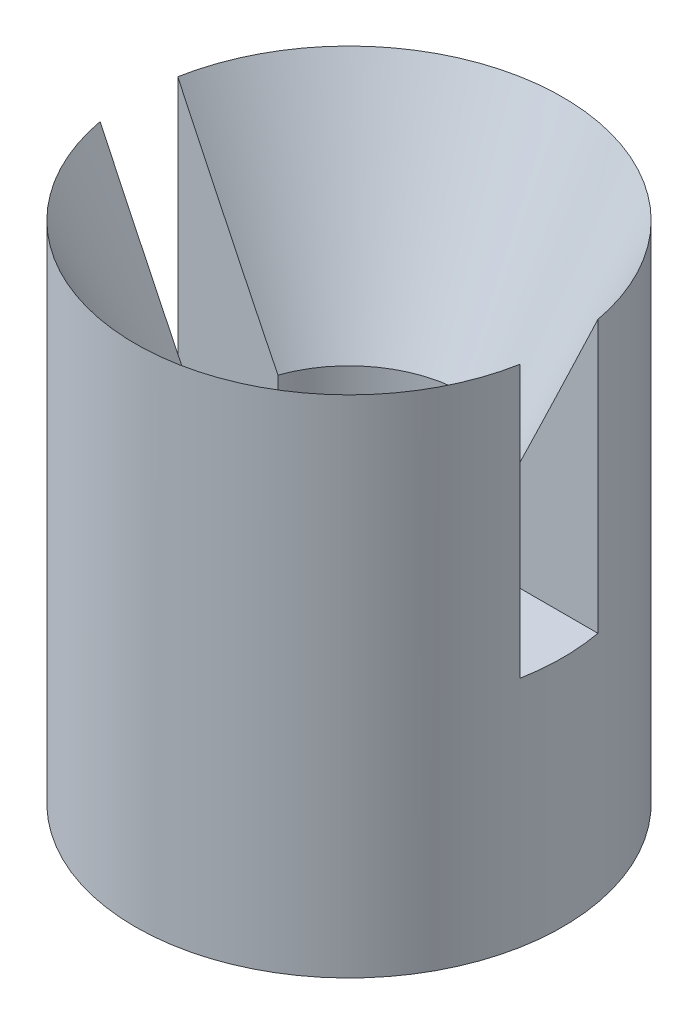
from build123d import *

# Parameters (mm, degrees)
SKETCH1_R           = 5.5
BOSS_EXTRUDE1_DEPTH = 13
SKETCH2_R           = 3
CUT_EXTRUDE1_DEPTH  = 7
CHAMFER1_SIZE       = 2.5
CHAMFER1_SIZE_2     = 5.361267301
SKETCH3_W           = 11.617421712
SKETCH3_H           = 2
CUT_EXTRUDE2_DEPTH  = 7
SKETCH4_R           = 2.5
CUT_EXTRUDE3_DEPTH  = 7
SKETCH5_R           = 1
CUT_EXTRUDE5_DEPTH  = 4


with BuildPart() as part:
    # Sketch1 → Boss-Extrude1 (new body)
    with BuildSketch(Plane(origin=(0, 0, 0), x_dir=(1, 0, 0), z_dir=(0, 1, 0))):
        with Locations(Location((0, 0, 0), (0, 0, 90))):
            Circle(SKETCH1_R)
    extrude(amount=BOSS_EXTRUDE1_DEPTH)

    # Sketch2 → Cut-Extrude1 (cut)
    with BuildSketch(Plane(origin=(0, 13, 0), x_dir=(1, 0, 0), z_dir=(0, 1, 0))):
        with Locations(Location((0, 0, 0), (0, 0, 270))):
            Circle(SKETCH2_R)
    extrude(amount=-CUT_EXTRUDE1_DEPTH, mode=Mode.SUBTRACT)

    # Chamfer1
    # the kernel refuses this chamfer: 5.361267301, 2.5 mm, written as the material it takes off along each edge
    with BuildSketch(Plane(origin=(0, 13, 0), x_dir=(0, 0, 1), z_dir=(-1, 0, 0))) as chamfer1_piece_1:
        Polygon((3 + CHAMFER1_SIZE, 0), (3, -CHAMFER1_SIZE_2), (3, 0), align=None)
    revolve(axis=Axis((0, 13, 0), (0, 1, 0)), mode=Mode.SUBTRACT)

    # Sketch3 → Cut-Extrude2 (cut)
    with BuildSketch(Plane(origin=(0, 13, 0), x_dir=(-1, 0, 0), z_dir=(0, -1, 0))):
        Rectangle(SKETCH3_W, SKETCH3_H)
    extrude(amount=CUT_EXTRUDE2_DEPTH, mode=Mode.SUBTRACT)

    # Sketch4 → Cut-Extrude3 (cut)
    with BuildSketch(Plane.XZ):
        with Locations(Location((0, 0, 0), (0, 0, 270))):
            Circle(SKETCH4_R)
    extrude(amount=-CUT_EXTRUDE3_DEPTH, mode=Mode.SUBTRACT)

    # Sketch5 → Cut-Extrude5 (cut)
    with BuildSketch(Plane(origin=(0, 0, -5.5), x_dir=(-1, 0, 0), z_dir=(0, 0, -1))):
        with Locations(Location((0, 4, 0), (0, 0, 90))):
            Circle(SKETCH5_R)
    extrude(amount=-CUT_EXTRUDE5_DEPTH, mode=Mode.SUBTRACT)


solid = part.part
